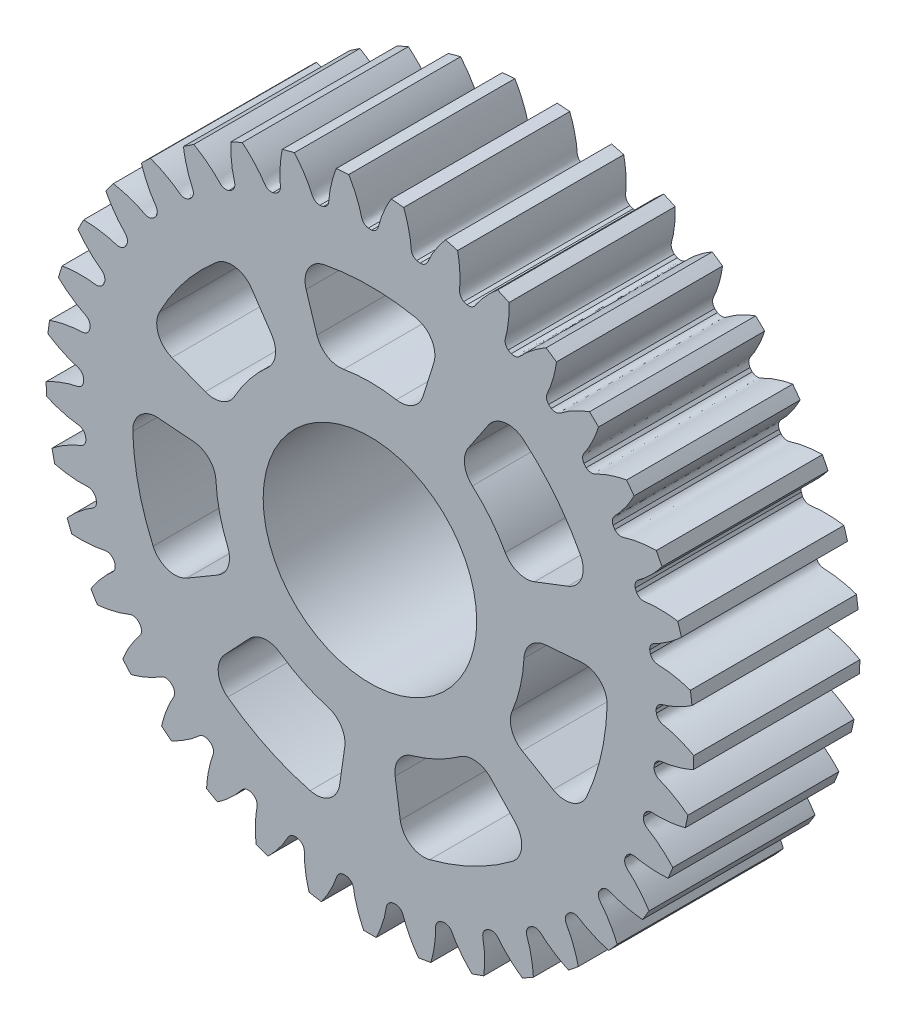
from build123d import *

# Parameters (mm, degrees)
SKETCH_1_R               = 13.650000004
EXTRUDE_1_DEPTH          = 7
CUT_EXTRUDE_1_DEPTH      = 21.533996206
PATTERN_CIRCULAR_1_COUNT = 37
CUT_EXTRUDE_2_DEPTH      = 21.531573338
CUT_EXTRUDE_2_DEPTH_BACK = 21.531573338
SKETCH_4_R               = 4.5
CUT_EXTRUDE_3_DEPTH      = 21.531573338
FILLET_1_R               = 1


with BuildPart() as part:
    # 草图1 → 凸台-拉伸1 (new body)
    with BuildSketch(Plane.XY):
        Circle(SKETCH_1_R)
    extrude(amount=EXTRUDE_1_DEPTH)

    # 草图2 → 切除-拉伸1 (cut, through all)
    with BuildSketch(Plane.XY):
        with BuildLine():
            ThreePointArc((0.072548017, 12.07478206), (0, 12.075), (-0.072548017, 12.07478206))
            add(Edge.make_bspline(
                [(-0.072548017, 12.07478206), (-0.32643695, 12.133549814), (-0.350715338, 12.325860688), (-0.40655333, 12.530168642), (-0.424128706, 12.590240885), (-0.444396932, 12.654576986), (-0.467490379, 12.72311323), (-0.493597854, 12.795753985), (-0.522888155, 12.872406213), (-0.55553264, 12.952969275), (-0.591698376, 13.037338036), (-0.631549971, 13.125402041), (-0.675248858, 13.217045852), (-0.722953332, 13.312149049), (-0.774818362, 13.410586338), (-0.830995478, 13.512227624), (-0.891632633, 13.616938104), (-0.956874083, 13.724578359), (-1.026860256, 13.835004447), (-1.101727631, 13.948068001), (-1.181608618, 14.063616333), (-1.266631442, 14.181492532), (-1.356920022, 14.301535578), (-1.452593865, 14.423580446), (-1.553767952, 14.547458225), (-1.660552631, 14.672996227), (-1.773053512, 14.80001811), (-1.891371375, 14.928343995), (-2.015602027, 15.057790597), (-2.191541279, 15.233927601), (-2.329240746, 15.363650181), (-2.42389024, 15.449398745)],
                knots=[0, 0, 0, 0, 0.123699995, 0.137556488, 0.152581606, 0.168775348, 0.186137716, 0.204668708, 0.224368325, 0.245236567, 0.267273434, 0.290478926, 0.314853043, 0.340395785, 0.367107152, 0.394987143, 0.42403576, 0.454253002, 0.485638868, 0.518193359, 0.551916476, 0.586808217, 0.622868583, 0.660097574, 0.69849519, 0.738061431, 0.778796297, 0.820699788, 0.863771903, 0.908012644, 1, 1, 1, 1], degree=3))
            ThreePointArc((-2.42389024, 15.449398745), (0, 15.63838756), (2.42389024, 15.449398745))
            add(Edge.make_bspline(
                [(0.072548017, 12.07478206), (0.32643695, 12.133549814), (0.350715338, 12.325860688), (0.40655333, 12.530168642), (0.424128706, 12.590240885), (0.444396932, 12.654576986), (0.467490379, 12.72311323), (0.493597854, 12.795753985), (0.522888155, 12.872406213), (0.55553264, 12.952969275), (0.591698376, 13.037338036), (0.631549971, 13.125402041), (0.675248858, 13.217045852), (0.722953332, 13.312149049), (0.774818362, 13.410586338), (0.830995478, 13.512227624), (0.891632633, 13.616938104), (0.956874083, 13.724578359), (1.026860256, 13.835004447), (1.101727631, 13.948068001), (1.181608618, 14.063616333), (1.266631442, 14.181492532), (1.356920022, 14.301535578), (1.452593865, 14.423580446), (1.553767952, 14.547458225), (1.660552631, 14.672996227), (1.773053512, 14.80001811), (1.891371375, 14.928343995), (2.015602027, 15.057790597), (2.191541279, 15.233927601), (2.329240746, 15.363650181), (2.42389024, 15.449398745)],
                knots=[0, 0, 0, 0, 0.123699995, 0.137556488, 0.152581606, 0.168775348, 0.186137716, 0.204668708, 0.224368325, 0.245236567, 0.267273434, 0.290478926, 0.314853043, 0.340395785, 0.367107152, 0.394987143, 0.42403576, 0.454253002, 0.485638868, 0.518193359, 0.551916476, 0.586808217, 0.622868583, 0.660097574, 0.69849519, 0.738061431, 0.778796297, 0.820699788, 0.863771903, 0.908012644, 1, 1, 1, 1], degree=3))
        make_face()
    cut_extrude_1 = extrude(amount=CUT_EXTRUDE_1_DEPTH, mode=Mode.SUBTRACT)

    # 阵列(圆周)1: 切除-拉伸1 ×37 about axis
    pattern_circular_1_axis = Axis((0, 0, -0.35), (0, 0, 1))
    for i in range(1, PATTERN_CIRCULAR_1_COUNT):
        add(cut_extrude_1.rotate(pattern_circular_1_axis, i * 360 / PATTERN_CIRCULAR_1_COUNT), mode=Mode.SUBTRACT)

    # 草图4 → 切除-拉伸2 (cut, two sides: drawn at the far end of the back side and taken through both)
    with BuildSketch(Plane.XY.offset(7).offset(-CUT_EXTRUDE_2_DEPTH_BACK)):
        Circle(SKETCH_4_R)
    extrude(amount=CUT_EXTRUDE_2_DEPTH + CUT_EXTRUDE_2_DEPTH_BACK, mode=Mode.SUBTRACT)

    # 草图5 → 切除-拉伸3 (cut, through all)
    with BuildSketch(Plane.XY.offset(7)):
        with BuildLine():
            Line((-3.007057995, 9.537169507), (-1.954587697, 6.19916018))
            ThreePointArc((-1.954587697, 6.19916018), (0, 6.5), (1.954587697, 6.19916018))
            Line((1.954587697, 6.19916018), (3.007057995, 9.537169507))
            ThreePointArc((3.007057995, 9.537169507), (0, 10), (-3.007057995, 9.537169507))
        make_face()
        with BuildLine():
            Line((5.581589381, 8.297340537), (3.628033098, 5.393271349))
            ThreePointArc((3.628033098, 5.393271349), (5.081904636, 4.052683712), (6.065364089, 2.336954956))
            Line((6.065364089, 2.336954956), (9.331329368, 3.595315316))
            ThreePointArc((9.331329368, 3.595315316), (7.818314825, 6.234898019), (5.581589381, 8.297340537))
        make_face()
        with BuildLine():
            Line((9.96718611, 0.809444907), (6.478670971, 0.526139189))
            ThreePointArc((6.478670971, 0.526139189), (6.337031429, -1.446386071), (5.608797612, -3.285025015))
            Line((5.608797612, -3.285025015), (8.628919403, -5.053884639))
            ThreePointArc((8.628919403, -5.053884639), (9.749279122, -2.22520934), (9.96718611, 0.809444907))
        make_face()
        with BuildLine():
            Line((6.847288404, -7.287979248), (4.450737463, -4.737186511))
            ThreePointArc((4.450737463, -4.737186511), (2.820244304, -5.856297641), (0.928692134, -6.433314148))
            Line((0.928692134, -6.433314148), (1.428757129, -9.897406381))
            ThreePointArc((1.428757129, -9.897406381), (4.338837391, -9.009688679), (6.847288404, -7.287979248))
        make_face()
        with BuildLine():
            Line((-1.428757129, -9.897406381), (-0.928692134, -6.433314148))
            ThreePointArc((-0.928692134, -6.433314148), (-2.820244304, -5.856297641), (-4.450737463, -4.737186511))
            Line((-4.450737463, -4.737186511), (-6.847288404, -7.287979248))
            ThreePointArc((-6.847288404, -7.287979248), (-4.338837391, -9.009688679), (-1.428757129, -9.897406381))
        make_face()
        with BuildLine():
            Line((-8.628919403, -5.053884639), (-5.608797612, -3.285025015))
            ThreePointArc((-5.608797612, -3.285025015), (-6.337031429, -1.446386071), (-6.478670971, 0.526139189))
            Line((-6.478670971, 0.526139189), (-9.96718611, 0.809444907))
            ThreePointArc((-9.96718611, 0.809444907), (-9.749279122, -2.22520934), (-8.628919403, -5.053884639))
        make_face()
        with BuildLine():
            Line((-9.331329368, 3.595315316), (-6.065364089, 2.336954956))
            ThreePointArc((-6.065364089, 2.336954956), (-5.081904636, 4.052683712), (-3.628033098, 5.393271349))
            Line((-3.628033098, 5.393271349), (-5.581589381, 8.297340537))
            ThreePointArc((-5.581589381, 8.297340537), (-7.818314825, 6.234898019), (-9.331329368, 3.595315316))
        make_face()
    extrude(amount=-CUT_EXTRUDE_3_DEPTH, mode=Mode.SUBTRACT)

    # 圆角1
    fillet_1_edges = [part.edges().sort_by_distance(p)[0] for p in [
        (1.954587697, 6.19916018, 3.5),
        (-1.954587697, 6.19916018, 3.5),
        (-3.007057995, 9.537169507, 3.5),
        (3.007057995, 9.537169507, 3.5),
        (-3.628033098, 5.393271349, 3.5),
        (-6.065364089, 2.336954956, 3.5),
        (-9.331329368, 3.595315316, 3.5),
        (-4.450737463, -4.737186511, 3.5),
        (-0.928692134, -6.433314148, 3.5),
        (-1.428757129, -9.897406381, 3.5),
        (-6.847288404, -7.287979248, 3.5),
        (-6.478670971, 0.526139189, 3.5),
        (-5.608797612, -3.285025015, 3.5),
        (-8.628919403, -5.053884639, 3.5),
        (-9.96718611, 0.809444907, 3.5),
        (6.065364089, 2.336954956, 3.5),
        (3.628033098, 5.393271349, 3.5),
        (5.581589381, 8.297340537, 3.5),
        (9.331329368, 3.595315316, 3.5),
        (5.608797612, -3.285025015, 3.5),
        (6.478670971, 0.526139189, 3.5),
        (9.96718611, 0.809444907, 3.5),
        (8.628919403, -5.053884639, 3.5),
        (0.928692134, -6.433314148, 3.5),
        (4.450737463, -4.737186511, 3.5),
        (6.847288404, -7.287979248, 3.5),
        (1.428757129, -9.897406381, 3.5),
        (-5.581589381, 8.297340537, 3.5),
    ]]
    fillet(fillet_1_edges, radius=FILLET_1_R)


solid = part.part
